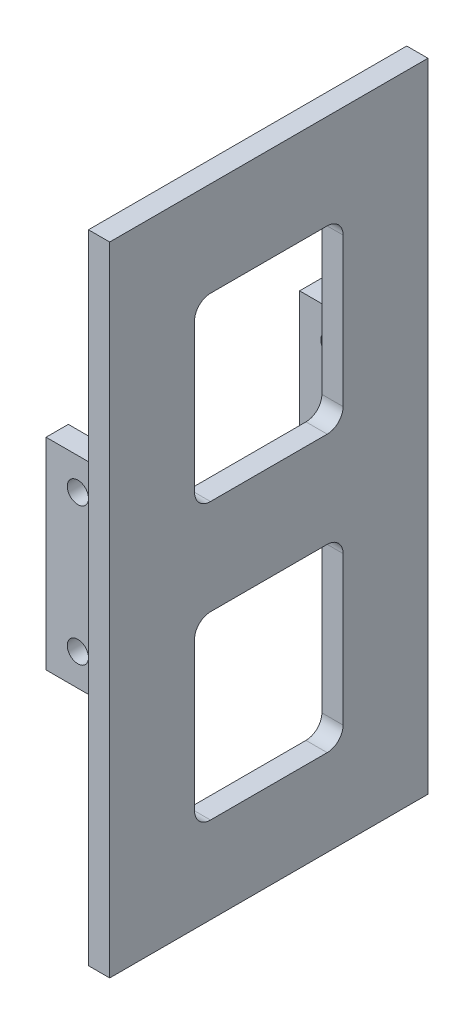
from build123d import *

# Parameters (mm, degrees)
CUT_EXTRUDE8_START       = -10
CUT_EXTRUDE8_OUTLINE_W   = 1.5
CUT_EXTRUDE8_OUTLINE_H   = 9
CUT_EXTRUDE8_DEPTH       = 30
CUT_EXTRUDE8_2_OUTLINE_W = 1.5
CUT_EXTRUDE8_2_OUTLINE_H = 17
CUT_EXTRUDE8_2_DEPTH     = 9.5
CUT_EXTRUDE8_START_2     = 10.5
CUT_EXTRUDE8_3_OUTLINE_W = 1.5
CUT_EXTRUDE8_3_OUTLINE_H = 17
CUT_EXTRUDE8_3_DEPTH     = 9.5
CUT_EXTRUDE9_START       = -2
CUT_EXTRUDE9_DEPTH       = 3
SKETCH8_W                = 44.763309207
SKETCH8_H                = 3.029199698
CUT_EXTRUDE10_DEPTH      = 21
SKETCH9_W                = 30
SKETCH9_H                = 60.083837712
BOSS_EXTRUDE3_DEPTH      = 2
SKETCH13_W               = 2.1
SKETCH13_H               = 19
BOSS_EXTRUDE5_DEPTH      = 6
SKETCH14_R               = 1
CUT_EXTRUDE12_DEPTH      = 6
FILLET1_R                = 1
FILLET1_OF_MIRROR1_R     = 1


with BuildPart() as part:
    # Cut-Extrude8: read off the stored shape, not the designer's step
    # Cut-Extrude8 outline → Cut-Extrude8 (new body)
    with BuildSketch(Plane.XY.offset(CUT_EXTRUDE8_START)):
        with BuildLine():
            Line((97, -39.3), (97, -32.3))
            ThreePointArc((97, -32.3), (96.58113883, -31.075255129), (95.5, -30.363508327))
            Line((95.5, -30.363508327), (95.5, -39.3))
            Line((95.5, -39.3), (97, -39.3))
        make_face()
        with Locations((96.25, -60.8)):
            Rectangle(CUT_EXTRUDE8_OUTLINE_W, CUT_EXTRUDE8_OUTLINE_H)
        with BuildLine():
            Line((97, -90.447346039), (97, -82.3))
            Line((97, -82.3), (95.5, -82.3))
            Line((95.5, -82.3), (95.5, -94.921216129))
            Line((95.5, -94.921216129), (96.879385242, -91.131386325))
            ThreePointArc((96.879385242, -91.131386325), (96.969615506, -90.794642394), (97, -90.447346039))
        make_face()
    extrude(amount=CUT_EXTRUDE8_DEPTH)

    # Cut-Extrude8 2 outline → Cut-Extrude8 2 (add)
    with BuildSketch(Plane.XY.offset(CUT_EXTRUDE8_START)):
        with Locations((96.25, -47.8)):
            Rectangle(CUT_EXTRUDE8_2_OUTLINE_W, CUT_EXTRUDE8_2_OUTLINE_H)
        with Locations((96.25, -73.8)):
            Rectangle(CUT_EXTRUDE8_2_OUTLINE_W, CUT_EXTRUDE8_2_OUTLINE_H)
    extrude(amount=CUT_EXTRUDE8_2_DEPTH)

    # Cut-Extrude8 3 outline → Cut-Extrude8 3 (add)
    with BuildSketch(Plane.XY.offset(CUT_EXTRUDE8_START_2)):
        with Locations((96.25, -47.8)):
            Rectangle(CUT_EXTRUDE8_3_OUTLINE_W, CUT_EXTRUDE8_3_OUTLINE_H)
        with Locations((96.25, -73.8)):
            Rectangle(CUT_EXTRUDE8_3_OUTLINE_W, CUT_EXTRUDE8_3_OUTLINE_H)
    extrude(amount=CUT_EXTRUDE8_3_DEPTH)

    # Cut-Extrude8 4: loft between two sections, ruled curve by curve
    cut_extrude8_4_from = [
        Edge.make_three_point_arc((94.954911098, -94.722819994, 16.513911403), (95.320152625, -93.719327147, 16.565596562), (95.497858615, -93.231083953, 17.5)),
        Edge.make_three_point_arc((95.497858615, -93.231083953, 17.5), (95.320152625, -93.719327147, 18.434403438), (94.954911098, -94.722819994, 18.486088597)),
        Edge.make_line((94.954911098, -94.722819994, 18.486088597), (94.954911098, -94.722819994, 16.513911403)),
    ]
    cut_extrude8_4_to = [
        Edge.make_three_point_arc((95.5, -94.921216129, 16.513911403), (95.865241526, -93.917723283, 16.565596562), (96.042947516, -93.429480088, 17.5)),
        Edge.make_three_point_arc((96.042947516, -93.429480088, 17.5), (95.865241526, -93.917723283, 18.434403438), (95.5, -94.921216129, 18.486088597)),
        Edge.make_line((95.5, -94.921216129, 18.486088597), (95.5, -94.921216129, 16.513911403)),
    ]
    cut_extrude8_4 = Solid(Shell([*[Face.make_surface_from_curves(cut_extrude8_4_from[k], cut_extrude8_4_to[k]) for k in range(3)], Face(Wire(cut_extrude8_4_from)), Face(Wire(cut_extrude8_4_to))]))
    add(cut_extrude8_4, mode=Mode.SUBTRACT)

    # Cut-Extrude8 5: loft between two sections, ruled curve by curve
    cut_extrude8_5_from = [
        Edge.make_three_point_arc((94.954911098, -94.722819994, -8.486088597), (95.320152625, -93.719327147, -8.434403438), (95.497858615, -93.231083953, -7.5)),
        Edge.make_three_point_arc((95.497858615, -93.231083953, -7.5), (95.320152625, -93.719327147, -6.565596562), (94.954911098, -94.722819994, -6.513911403)),
        Edge.make_line((94.954911098, -94.722819994, -6.513911403), (94.954911098, -94.722819994, -8.486088597)),
    ]
    cut_extrude8_5_to = [
        Edge.make_three_point_arc((95.5, -94.921216129, -8.486088597), (95.865241526, -93.917723283, -8.434403438), (96.042947516, -93.429480088, -7.5)),
        Edge.make_three_point_arc((96.042947516, -93.429480088, -7.5), (95.865241526, -93.917723283, -6.565596562), (95.5, -94.921216129, -6.513911403)),
        Edge.make_line((95.5, -94.921216129, -6.513911403), (95.5, -94.921216129, -8.486088597)),
    ]
    cut_extrude8_5 = Solid(Shell([*[Face.make_surface_from_curves(cut_extrude8_5_from[k], cut_extrude8_5_to[k]) for k in range(3)], Face(Wire(cut_extrude8_5_from)), Face(Wire(cut_extrude8_5_to))]))
    add(cut_extrude8_5, mode=Mode.SUBTRACT)

    # Cut-Extrude8 6: loft between two sections, ruled curve by curve
    cut_extrude8_6_from = [
        Edge.make_three_point_arc((97, -54.8, -2), (97, -55.860660172, -1.560660172), (97, -56.3, -0.5)),
        Edge.make_three_point_arc((97, -39.3, -0.5), (97, -39.739339828, -1.560660172), (97, -40.8, -2)),
        Edge.make_line((97, -40.8, -2), (97, -54.8, -2)),
        Edge.make_line((97, -39.3, -0.5), (97, -56.3, -0.5)),
    ]
    cut_extrude8_6_to = [
        Edge.make_three_point_arc((95.5, -54.8, -2), (95.5, -55.860660172, -1.560660172), (95.5, -56.3, -0.5)),
        Edge.make_three_point_arc((95.5, -39.3, -0.5), (95.5, -39.739339828, -1.560660172), (95.5, -40.8, -2)),
        Edge.make_line((95.5, -40.8, -2), (95.5, -54.8, -2)),
        Edge.make_line((95.5, -39.3, -0.5), (95.5, -56.3, -0.5)),
    ]
    cut_extrude8_6 = Solid(Shell([*[Face.make_surface_from_curves(cut_extrude8_6_from[k], cut_extrude8_6_to[k]) for k in range(4)], Face(Wire(cut_extrude8_6_from)), Face(Wire(cut_extrude8_6_to))]))
    add(cut_extrude8_6, mode=Mode.SUBTRACT)

    # Cut-Extrude8 7: loft between two sections, ruled curve by curve
    cut_extrude8_7_from = [
        Edge.make_three_point_arc((97, -65.3, -0.5), (97, -65.739339828, -1.560660172), (97, -66.8, -2)),
        Edge.make_three_point_arc((97, -80.8, -2), (97, -81.860660172, -1.560660172), (97, -82.3, -0.5)),
        Edge.make_line((97, -66.8, -2), (97, -80.8, -2)),
        Edge.make_line((97, -82.3, -0.5), (97, -65.3, -0.5)),
    ]
    cut_extrude8_7_to = [
        Edge.make_three_point_arc((95.5, -65.3, -0.5), (95.5, -65.739339828, -1.560660172), (95.5, -66.8, -2)),
        Edge.make_three_point_arc((95.5, -80.8, -2), (95.5, -81.860660172, -1.560660172), (95.5, -82.3, -0.5)),
        Edge.make_line((95.5, -66.8, -2), (95.5, -80.8, -2)),
        Edge.make_line((95.5, -82.3, -0.5), (95.5, -65.3, -0.5)),
    ]
    cut_extrude8_7 = Solid(Shell([*[Face.make_surface_from_curves(cut_extrude8_7_from[k], cut_extrude8_7_to[k]) for k in range(4)], Face(Wire(cut_extrude8_7_from)), Face(Wire(cut_extrude8_7_to))]))
    add(cut_extrude8_7, mode=Mode.SUBTRACT)

    # Cut-Extrude8 8: loft between two sections, ruled curve by curve
    cut_extrude8_8_from = [
        Edge.make_three_point_arc((97, -56.3, 10.5), (97, -55.860660172, 11.560660172), (97, -54.8, 12)),
        Edge.make_three_point_arc((97, -40.8, 12), (97, -39.739339828, 11.560660172), (97, -39.3, 10.5)),
        Edge.make_line((97, -40.8, 12), (97, -54.8, 12)),
        Edge.make_line((97, -39.3, 10.5), (97, -56.3, 10.5)),
    ]
    cut_extrude8_8_to = [
        Edge.make_three_point_arc((95.5, -56.3, 10.5), (95.5, -55.860660172, 11.560660172), (95.5, -54.8, 12)),
        Edge.make_three_point_arc((95.5, -40.8, 12), (95.5, -39.739339828, 11.560660172), (95.5, -39.3, 10.5)),
        Edge.make_line((95.5, -40.8, 12), (95.5, -54.8, 12)),
        Edge.make_line((95.5, -39.3, 10.5), (95.5, -56.3, 10.5)),
    ]
    cut_extrude8_8 = Solid(Shell([*[Face.make_surface_from_curves(cut_extrude8_8_from[k], cut_extrude8_8_to[k]) for k in range(4)], Face(Wire(cut_extrude8_8_from)), Face(Wire(cut_extrude8_8_to))]))
    add(cut_extrude8_8, mode=Mode.SUBTRACT)

    # Cut-Extrude8 9: loft between two sections, ruled curve by curve
    cut_extrude8_9_from = [
        Edge.make_three_point_arc((97, -82.3, 10.5), (97, -81.860660172, 11.560660172), (97, -80.8, 12)),
        Edge.make_three_point_arc((97, -66.8, 12), (97, -65.739339828, 11.560660172), (97, -65.3, 10.5)),
        Edge.make_line((97, -66.8, 12), (97, -80.8, 12)),
        Edge.make_line((97, -65.3, 10.5), (97, -82.3, 10.5)),
    ]
    cut_extrude8_9_to = [
        Edge.make_three_point_arc((95.5, -82.3, 10.5), (95.5, -81.860660172, 11.560660172), (95.5, -80.8, 12)),
        Edge.make_three_point_arc((95.5, -66.8, 12), (95.5, -65.739339828, 11.560660172), (95.5, -65.3, 10.5)),
        Edge.make_line((95.5, -66.8, 12), (95.5, -80.8, 12)),
        Edge.make_line((95.5, -65.3, 10.5), (95.5, -82.3, 10.5)),
    ]
    cut_extrude8_9 = Solid(Shell([*[Face.make_surface_from_curves(cut_extrude8_9_from[k], cut_extrude8_9_to[k]) for k in range(4)], Face(Wire(cut_extrude8_9_from)), Face(Wire(cut_extrude8_9_to))]))
    add(cut_extrude8_9, mode=Mode.SUBTRACT)

    # Cut-Extrude8 10: loft between two sections, ruled curve by curve
    cut_extrude8_10_from = [
        Edge.make_three_point_arc((95.5, -75.3, 16.4), (95.5, -74.2, 17.5), (95.5, -75.3, 18.6)),
        Edge.make_three_point_arc((95.5, -75.3, 18.6), (95.5, -76.4, 17.5), (95.5, -75.3, 16.4)),
    ]
    cut_extrude8_10_to = [
        Edge.make_three_point_arc((97, -75.3, 16.4), (97, -74.2, 17.5), (97, -75.3, 18.6)),
        Edge.make_three_point_arc((97, -75.3, 18.6), (97, -76.4, 17.5), (97, -75.3, 16.4)),
    ]
    cut_extrude8_10 = Solid(Shell([*[Face.make_surface_from_curves(cut_extrude8_10_from[k], cut_extrude8_10_to[k]) for k in range(2)], Face(Wire(cut_extrude8_10_from)), Face(Wire(cut_extrude8_10_to))]))
    add(cut_extrude8_10, mode=Mode.SUBTRACT)

    # Cut-Extrude8 11: loft between two sections, ruled curve by curve
    cut_extrude8_11_from = [
        Edge.make_three_point_arc((95.5, -46.3, 16.4), (95.5, -45.2, 17.5), (95.5, -46.3, 18.6)),
        Edge.make_three_point_arc((95.5, -46.3, 18.6), (95.5, -47.4, 17.5), (95.5, -46.3, 16.4)),
    ]
    cut_extrude8_11_to = [
        Edge.make_three_point_arc((97, -46.3, 16.4), (97, -45.2, 17.5), (97, -46.3, 18.6)),
        Edge.make_three_point_arc((97, -46.3, 18.6), (97, -47.4, 17.5), (97, -46.3, 16.4)),
    ]
    cut_extrude8_11 = Solid(Shell([*[Face.make_surface_from_curves(cut_extrude8_11_from[k], cut_extrude8_11_to[k]) for k in range(2)], Face(Wire(cut_extrude8_11_from)), Face(Wire(cut_extrude8_11_to))]))
    add(cut_extrude8_11, mode=Mode.SUBTRACT)

    # Cut-Extrude8 12: loft between two sections, ruled curve by curve
    cut_extrude8_12_from = [
        Edge.make_three_point_arc((95.5, -75.3, -8.6), (95.5, -74.2, -7.5), (95.5, -75.3, -6.4)),
        Edge.make_three_point_arc((95.5, -75.3, -6.4), (95.5, -76.4, -7.5), (95.5, -75.3, -8.6)),
    ]
    cut_extrude8_12_to = [
        Edge.make_three_point_arc((97, -75.3, -8.6), (97, -74.2, -7.5), (97, -75.3, -6.4)),
        Edge.make_three_point_arc((97, -75.3, -6.4), (97, -76.4, -7.5), (97, -75.3, -8.6)),
    ]
    cut_extrude8_12 = Solid(Shell([*[Face.make_surface_from_curves(cut_extrude8_12_from[k], cut_extrude8_12_to[k]) for k in range(2)], Face(Wire(cut_extrude8_12_from)), Face(Wire(cut_extrude8_12_to))]))
    add(cut_extrude8_12, mode=Mode.SUBTRACT)

    # Cut-Extrude8 13: loft between two sections, ruled curve by curve
    cut_extrude8_13_from = [
        Edge.make_three_point_arc((95.5, -46.3, -8.6), (95.5, -45.2, -7.5), (95.5, -46.3, -6.4)),
        Edge.make_three_point_arc((95.5, -46.3, -6.4), (95.5, -47.4, -7.5), (95.5, -46.3, -8.6)),
    ]
    cut_extrude8_13_to = [
        Edge.make_three_point_arc((97, -46.3, -8.6), (97, -45.2, -7.5), (97, -46.3, -6.4)),
        Edge.make_three_point_arc((97, -46.3, -6.4), (97, -47.4, -7.5), (97, -46.3, -8.6)),
    ]
    cut_extrude8_13 = Solid(Shell([*[Face.make_surface_from_curves(cut_extrude8_13_from[k], cut_extrude8_13_to[k]) for k in range(2)], Face(Wire(cut_extrude8_13_from)), Face(Wire(cut_extrude8_13_to))]))
    add(cut_extrude8_13, mode=Mode.SUBTRACT)

    # Cut-Extrude9: read off the stored shape, not the designer's step
    # Cut-Extrude9 outline → Cut-Extrude9 (cut)
    with BuildSketch(Plane.ZY.offset(-95.5).offset(CUT_EXTRUDE9_START)):
        with BuildLine():
            Line((-10, -94.921216129), (-8.486088597, -94.921216129))
            add(Edge.make_bspline(
                [(-8.486088597, -94.921216129), (-8.528622211, -94.840365377), (-8.56433173, -94.750294794), (-8.590341572, -94.651077369), (-8.602806532, -94.544671361), (-8.590253721, -94.116362583), (-8.444290191, -93.745116805), (-8.117111171, -93.513621081), (-7.777782646, -93.429480088), (-7.222217354, -93.429480088), (-6.882888829, -93.513621081), (-6.555709809, -93.745116805), (-6.409746279, -94.116362583), (-6.397193468, -94.544671361), (-6.409658428, -94.651077369), (-6.43566827, -94.750294794), (-6.471377789, -94.840365377), (-6.513911403, -94.921216129)],
                knots=[6.221037859, 6.221037859, 6.221037859, 6.221037859, 6.221037859, 6.221037859, 6.742302252, 6.742302252, 6.742302252, 6.742302252, 8.250951131, 8.250951131, 8.250951131, 8.250951131, 9.75960001, 9.75960001, 9.75960001, 9.75960001, 10.280864403, 10.280864403, 10.280864403, 10.280864403, 10.280864403, 10.280864403], degree=5, weights=[1, 1, 1.000250109, 1.000114964, 1, 1, 0.966437741, 0.979277403, 1, 1, 0.979277403, 0.966437741, 1, 1, 1.000114964, 1.000250109, 1, 1]))
            Line((-6.513911403, -94.921216129), (16.513911403, -94.921216129))
            add(Edge.make_bspline(
                [(16.513911403, -94.921216129), (16.471377789, -94.840365377), (16.43566827, -94.750294794), (16.409658428, -94.651077369), (16.397193468, -94.544671361), (16.409746279, -94.116362583), (16.555709809, -93.745116805), (16.882888829, -93.513621081), (17.222217354, -93.429480088), (17.777782646, -93.429480088), (18.117111171, -93.513621081), (18.444290191, -93.745116805), (18.590253721, -94.116362583), (18.602806532, -94.544671361), (18.590341572, -94.651077369), (18.56433173, -94.750294794), (18.528622211, -94.840365377), (18.486088597, -94.921216129)],
                knots=[6.221037859, 6.221037859, 6.221037859, 6.221037859, 6.221037859, 6.221037859, 6.742302252, 6.742302252, 6.742302252, 6.742302252, 8.250951131, 8.250951131, 8.250951131, 8.250951131, 9.75960001, 9.75960001, 9.75960001, 9.75960001, 10.280864403, 10.280864403, 10.280864403, 10.280864403, 10.280864403, 10.280864403], degree=5, weights=[1, 1, 1.000250109, 1.000114964, 1, 1, 0.966437741, 0.979277403, 1, 1, 0.979277403, 0.966437741, 1, 1, 1.000114964, 1.000250109, 1, 1]))
            Line((18.486088597, -94.921216129), (20, -94.921216129))
            Line((20, -94.921216129), (20, -90.447346039))
            Line((20, -90.447346039), (-10, -90.447346039))
            Line((-10, -90.447346039), (-10, -94.921216129))
        make_face()
    extrude(amount=CUT_EXTRUDE9_DEPTH, mode=Mode.SUBTRACT)

    # Sketch8 → Cut-Extrude10 (cut, symmetric)
    with BuildSketch(Plane.ZY.offset(-95.5)):
        with Locations((1.902623412, -94.949992123)):
            Rectangle(SKETCH8_W, SKETCH8_H)
    extrude(amount=CUT_EXTRUDE10_DEPTH, both=True, mode=Mode.SUBTRACT)

    # Sketch9 → Boss-Extrude3 (add)
    with BuildSketch(Plane.ZY.offset(-95.5)):
        with Locations((5, -60.405427183)):
            Rectangle(SKETCH9_W, SKETCH9_H)
        with BuildLine():
            Line((-0.5, -82.3), (10.5, -82.3))
            ThreePointArc((10.5, -82.3), (11.560660172, -81.860660172), (12, -80.8))
            Line((12, -80.8), (12, -66.8))
            ThreePointArc((12, -66.8), (11.560660172, -65.739339828), (10.5, -65.3))
            Line((10.5, -65.3), (-0.5, -65.3))
            ThreePointArc((-0.5, -65.3), (-1.560660172, -65.739339828), (-2, -66.8))
            Line((-2, -66.8), (-2, -80.8))
            ThreePointArc((-2, -80.8), (-1.560660172, -81.860660172), (-0.5, -82.3))
        make_face(mode=Mode.SUBTRACT)
        with BuildLine():
            Line((12, -54.8), (12, -40.8))
            ThreePointArc((12, -40.8), (11.560660172, -39.739339828), (10.5, -39.3))
            Line((10.5, -39.3), (-0.5, -39.3))
            ThreePointArc((-0.5, -39.3), (-1.560660172, -39.739339828), (-2, -40.8))
            Line((-2, -40.8), (-2, -54.8))
            ThreePointArc((-2, -54.8), (-1.560660172, -55.860660172), (-0.5, -56.3))
            Line((-0.5, -56.3), (10.5, -56.3))
            ThreePointArc((10.5, -56.3), (11.560660172, -55.860660172), (12, -54.8))
        make_face(mode=Mode.SUBTRACT)
    extrude(amount=-BOSS_EXTRUDE3_DEPTH)

    # Sketch13 → Boss-Extrude5 (add)
    with BuildSketch(Plane.ZY.offset(-95.5)):
        with Locations((-6.95, -60.8)):
            Rectangle(SKETCH13_W, SKETCH13_H)
    boss_extrude5 = extrude(amount=BOSS_EXTRUDE5_DEPTH)

    # Sketch14 → Cut-Extrude12 (cut)
    with BuildSketch(Plane.XY.offset(-5.9)):
        with Locations((92.5, -54.3)):
            Circle(SKETCH14_R)
        with Locations((92.5, -67.3)):
            Circle(SKETCH14_R)
    cut_extrude12 = extrude(amount=-CUT_EXTRUDE12_DEPTH, mode=Mode.SUBTRACT)

    # Fillet1
    fillet1_edges = [part.edges().sort_by_distance(p)[0] for p in [
        (95.5, -51.3, -6.95),
        (95.5, -70.3, -6.95),
        (95.5, -60.8, -5.9),
    ]]
    fillet(fillet1_edges, radius=FILLET1_R)

    # Mirror1: Boss-Extrude5, Cut-Extrude12 across plane
    add(boss_extrude5.mirror(Plane(origin=(0, 0, 5), x_dir=(1, 0, 0), z_dir=(0, 0, -1))))
    add(cut_extrude12.mirror(Plane(origin=(0, 0, 5), x_dir=(1, 0, 0), z_dir=(0, 0, -1))), mode=Mode.SUBTRACT)

    # Fillet1 of Mirror1
    fillet1_of_mirror1_edges = [part.edges().sort_by_distance(p)[0] for p in [
        (95.5, -51.3, 16.95),
        (95.5, -70.3, 16.95),
        (95.5, -60.8, 15.9),
    ]]
    fillet(fillet1_of_mirror1_edges, radius=FILLET1_OF_MIRROR1_R)


solid = part.part
